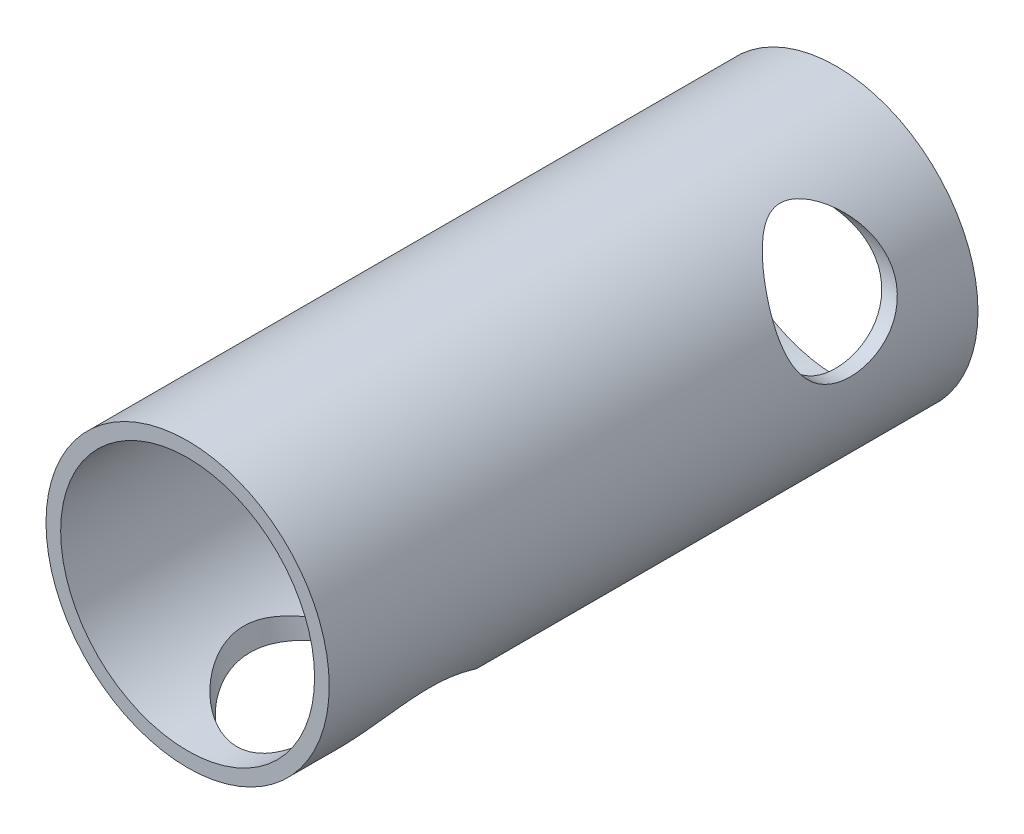
from build123d import *

# Parameters (mm, degrees)
BOSS_EXTRUDE1_DEPTH = 101.75
CUT_EXTRUDE2_REACH  = 116.356
SKETCH5_R           = 14.8463
CUT_EXTRUDE3_REACH  = 115.223
SKETCH4_R           = 9.0424


with BuildPart() as part:
    # Sketch1 → Boss-Extrude1 (new body)
    with BuildSketch(Plane.XY):
        with BuildLine():
            ThreePointArc((22.160563267, 0), (-0.505626758, 22.205314469), (-22.240696585, -0.91218757))
            ThreePointArc((-22.240696585, -0.91218757), (0.406753293, -22.205314469), (22.160563267, 0))
        make_face()
        with BuildLine():
            ThreePointArc((19.860563267, 0), (0.359511642, -19.905799688), (-19.942637258, -0.817724202))
            ThreePointArc((-19.942637258, -0.817724202), (-0.458385107, 19.905799688), (19.860563267, 0))
        make_face(mode=Mode.SUBTRACT)
    extrude(amount=BOSS_EXTRUDE1_DEPTH)

    # Sketch5 → Cut-Extrude2 (cut, up to next)
    with BuildSketch(Plane(origin=(6.858531279, -21.108388805, 101.75), x_dir=(-0.9504002163594892, -0.31102962679435553, 0), z_dir=(0.31102962679435553, -0.9504002163594892, 0)), mode=Mode.PRIVATE) as cut_extrude2_sk1:
        with Locations((-0.049436639, 18.7)):
            Circle(SKETCH5_R)
    cut_extrude2_tool1 = extrude(cut_extrude2_sk1.sketch, amount=-CUT_EXTRUDE2_REACH, mode=Mode.PRIVATE) & part.part
    add(cut_extrude2_tool1.solids().sort_by_distance((6.905516, -21.093013, 83.05))[0], mode=Mode.SUBTRACT)

    # Sketch4 → Cut-Extrude3 (cut, up to next)
    with BuildSketch(Plane(origin=(22.160563267, 0, 101.75), x_dir=(0, 0, -1), z_dir=(1, 0, 0)), mode=Mode.PRIVATE) as cut_extrude3_sk1:
        with Locations((81.75, 10.153466667)):
            Circle(SKETCH4_R)
    cut_extrude3_tool1 = extrude(cut_extrude3_sk1.sketch, amount=-CUT_EXTRUDE3_REACH, mode=Mode.PRIVATE) & part.part
    add(cut_extrude3_tool1.solids().sort_by_distance((22.160563, 10.153467, 20))[0], mode=Mode.SUBTRACT)


solid = part.part
